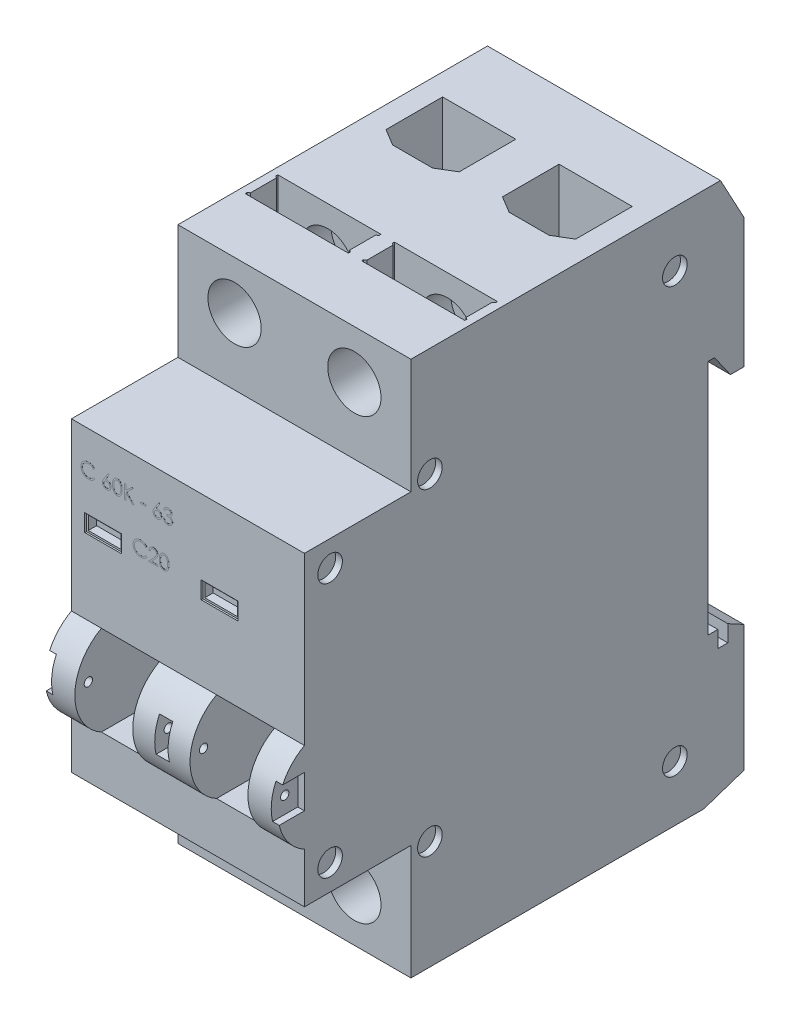
from build123d import *

# Parameters (mm, degrees)
SALIENTE_EXTRUIR1_DEPTH      = 17.5
SALIENTE_EXTRUIR1_DEPTH_BACK = 17.5
CROQUIS2_R                   = 1.85
CORTAR_EXTRUIR1_DEPTH        = 1
CORTAR_EXTRUIR2_DEPTH        = 12.5
CROQUIS4_R                   = 4
CORTAR_EXTRUIR3_DEPTH        = 18.5
CROQUIS5_W                   = 5.5
CROQUIS5_H                   = 2.6
CORTAR_EXTRUIR4_DEPTH        = 0.25
CROQUIS6_W                   = 4.940246398
CROQUIS6_H                   = 2.03169495
CROQUIS6_W_2                 = 4.94
CORTAR_EXTRUIR5_DEPTH        = 1.25
CORTAR_EXTRUIR6_DEPTH        = 10.25
CORTAR_EXTRUIR6_DEPTH_BACK   = 13.25
CROQUIS7_W                   = 8.7
CROQUIS7_H                   = 13.5
CROQUIS8_W                   = 8
CROQUIS8_H                   = 2
CORTAR_EXTRUIR7_DEPTH        = 5
CORTAR_EXTRUIR8_DEPTH        = 3
REDONDEO1_R                  = 0.25
REDONDEO2_R                  = 1
CORTAR_EXTRUIR9_DEPTH        = 3
CORTAR_EXTRUIR9_DEPTH_BACK   = 3
CROQUIS11_W                  = 2
CROQUIS11_H                  = 5
CROQUIS11_W_2                = 1
CROQUIS12_R                  = 0.625
CORTAR_EXTRUIR10_DEPTH       = 35
SALIENTE_EXTRUIR2_DEPTH      = 0.01
SALIENTE_EXTRUIR2_2_DEPTH    = 0.01
SALIENTE_EXTRUIR2_3_DEPTH    = 0.01
SALIENTE_EXTRUIR2_4_DEPTH    = 0.01
CROQUIS13_W                  = 0.814102564
CROQUIS13_H                  = 0.217094017
SALIENTE_EXTRUIR2_5_DEPTH    = 0.01
SALIENTE_EXTRUIR2_6_DEPTH    = 0.01
SALIENTE_EXTRUIR2_7_DEPTH    = 0.01
SALIENTE_EXTRUIR2_8_DEPTH    = 0.01
SALIENTE_EXTRUIR2_9_DEPTH    = 0.01
SALIENTE_EXTRUIR2_10_DEPTH   = 0.01


with BuildPart() as part:
    # Croquis1 → Saliente-Extruir1 (new, two sides: drawn at the far end of the back side and taken through both)
    with BuildSketch(Plane(origin=(0, 0, 0), x_dir=(0, 0, -1), z_dir=(1, 0, 0)).offset(-SALIENTE_EXTRUIR1_DEPTH_BACK)):
        with BuildLine():
            Line((-33, 23), (-17, 23))
            Line((-17, 23), (-17, 40.25))
            Line((-17, 40.25), (29.5, 40.25))
            Line((29.5, 40.25), (33, 33.75))
            Line((33, 33.75), (33, 14.25))
            Line((33, 14.25), (31, 14.25))
            Line((31, 14.25), (28.6, 17.65))
            Line((28.6, 17.65), (27.6, 17.65))
            Line((27.6, 17.65), (27.6, -17.95))
            Line((27.6, -17.95), (29.1, -17.95))
            Line((29.1, -17.95), (29.1, -20.45))
            Line((29.1, -20.45), (30.6, -20.45))
            Line((30.6, -20.45), (30.6, -17.95))
            Line((30.6, -17.95), (33, -19.25))
            Line((33, -19.25), (33, -38.25))
            Line((33, -38.25), (27, -40.25))
            Line((27, -40.25), (-17, -40.25))
            Line((-17, -40.25), (-17, -23))
            Line((-17, -23), (-33, -23))
            Line((-33, -23), (-33, -15.5))
            ThreePointArc((-33, -15.5), (-36.988145156, -8.75), (-33, -2))
            Line((-33, -2), (-33, 23))
        make_face()
    extrude(amount=SALIENTE_EXTRUIR1_DEPTH + SALIENTE_EXTRUIR1_DEPTH_BACK)

    # Croquis2 → Cortar-Extruir1 (cut)
    with BuildSketch(Plane(origin=(17.5, 0, 0), x_dir=(0, 0, -1), z_dir=(1, 0, 0))):
        with Locations((-14.15, 23.9)):
            Circle(CROQUIS2_R)
        with Locations((22.65, 31.9)):
            Circle(CROQUIS2_R)
        with Locations((-29.15, 19.15)):
            Circle(CROQUIS2_R)
        with Locations((22.65, -31.9)):
            Circle(CROQUIS2_R)
        with Locations((-14.15, -23.9)):
            Circle(CROQUIS2_R)
        with Locations((-29.15, -19.15)):
            Circle(CROQUIS2_R)
    cortar_extruir1 = extrude(amount=-CORTAR_EXTRUIR1_DEPTH, mode=Mode.SUBTRACT)

    # Simetría1: Cortar-Extruir1 across plane
    add(cortar_extruir1.mirror(Plane(origin=(0, 0, 0), x_dir=(0, 0, 1), z_dir=(1, 0, 0))), mode=Mode.SUBTRACT)

    # Croquis3 → Cortar-Extruir2 (cut)
    with BuildSketch(Plane(origin=(0, 40.25, 0), x_dir=(1, 0, 0), z_dir=(0, 1, 0))):
        Polygon((1, -3), (16.5, -3), (16.5, -3.3), (16.2, -3.5), (16.2, -7.4), (16.5, -7.6), (16.5, -7.9), (1, -7.9), (1, -7.6), (1.3, -7.4), (1.3, -3.5), (1, -3.3), align=None)
        Polygon((3.25, 19.5), (14.25, 19.5), (14.25, 11), (11.75, 9.5), (5.75, 9.5), (3.25, 11), align=None)
        Polygon((-3.25, 19.5), (-3.25, 11), (-5.75, 9.5), (-11.75, 9.5), (-14.25, 11), (-14.25, 19.5), align=None)
        Polygon((-1, -3), (-1, -3.3), (-1.3, -3.5), (-1.3, -7.4), (-1, -7.6), (-1, -7.9), (-16.5, -7.9), (-16.5, -7.6), (-16.2, -7.4), (-16.2, -3.5), (-16.5, -3.3), (-16.5, -3), align=None)
    cortar_extruir2 = extrude(amount=-CORTAR_EXTRUIR2_DEPTH, mode=Mode.SUBTRACT)

    # Simetría2: Cortar-Extruir2 across plane
    add(cortar_extruir2.mirror(Plane.ZX), mode=Mode.SUBTRACT)

    # Croquis4 → Cortar-Extruir3 (cut)
    with BuildSketch(Plane.XY.offset(17)):
        with Locations((9, 33)):
            Circle(CROQUIS4_R)
        with Locations((-9, 33)):
            Circle(CROQUIS4_R)
    cortar_extruir3 = extrude(amount=-CORTAR_EXTRUIR3_DEPTH, mode=Mode.SUBTRACT)

    # Simetría3: Cortar-Extruir3 across plane
    add(cortar_extruir3.mirror(Plane.ZX), mode=Mode.SUBTRACT)

    # Croquis5 → Cortar-Extruir4 (cut)
    with BuildSketch(Plane.XY.offset(33)):
        with Locations((-12.75, 10.5)):
            Rectangle(CROQUIS5_W, CROQUIS5_H)
        with Locations((4.75, 10.5)):
            Rectangle(CROQUIS5_W, CROQUIS5_H)
    extrude(amount=-CORTAR_EXTRUIR4_DEPTH, mode=Mode.SUBTRACT)

    # Croquis6 → Cortar-Extruir5 (cut)
    with BuildSketch(Plane.XY.offset(32.75)):
        with Locations((-12.75, 10.5)):
            Rectangle(CROQUIS6_W, CROQUIS6_H)
        with Locations((4.75, 10.5)):
            Rectangle(CROQUIS6_W_2, CROQUIS6_H)
    extrude(amount=-CORTAR_EXTRUIR5_DEPTH, mode=Mode.SUBTRACT)

    # Croquis7 → Cortar-Extruir6 (cut, two sides: drawn at the far end of the back side and taken through both)
    with BuildSketch(Plane.XY.offset(33).offset(-CORTAR_EXTRUIR6_DEPTH_BACK)):
        with Locations((8.65, -8.75)):
            Rectangle(CROQUIS7_W, CROQUIS7_H)
        with Locations((-8.65, -8.75)):
            Rectangle(CROQUIS7_W, CROQUIS7_H)
    extrude(amount=CORTAR_EXTRUIR6_DEPTH + CORTAR_EXTRUIR6_DEPTH_BACK, mode=Mode.SUBTRACT)

    # Croquis8 → Cortar-Extruir7 (cut)
    with BuildSketch(Plane.XZ.offset(40.25)):
        with Locations((8.75, -24)):
            Rectangle(CROQUIS8_W, CROQUIS8_H)
        with Locations((-8.75, -24)):
            Rectangle(CROQUIS8_W, CROQUIS8_H)
    extrude(amount=-CORTAR_EXTRUIR7_DEPTH, mode=Mode.SUBTRACT)

    # Croquis10 → Cortar-Extruir8 (cut)
    with BuildSketch(Plane(origin=(0, 0, -33), x_dir=(-1, 0, 0), z_dir=(0, 0, -1))):
        Polygon((13.5, -32.25), (13.5, -19.25), (13.441464629, -19.25), (13.441464629, -22.108941141), (11.2, -22.75), (11.2, -26.25), (10.2, -26.25), (10.2, -38.25), (10.3, -38.25), (10.3, -32.25), align=None)
        Polygon((4.058535371, -22.108941141), (4.058535371, -19.25), (4, -19.25), (4, -32.25), (7.2, -32.25), (7.2, -38.25), (7.3, -38.25), (7.3, -26.25), (6.3, -26.25), (6.3, -22.75), align=None)
        Polygon((-4, -32.25), (-4, -19.25), (-4.058535371, -19.25), (-4.058535371, -22.108941141), (-6.3, -22.75), (-6.3, -26.25), (-7.3, -26.25), (-7.3, -38.25), (-7.2, -38.25), (-7.2, -32.25), align=None)
        Polygon((-13.441464629, -22.108941141), (-13.441464629, -19.25), (-13.5, -19.25), (-13.5, -32.25), (-10.3, -32.25), (-10.3, -38.25), (-10.2, -38.25), (-10.2, -26.25), (-11.2, -26.25), (-11.2, -22.75), align=None)
    extrude(amount=-CORTAR_EXTRUIR8_DEPTH, mode=Mode.SUBTRACT)

    # Redondeo1
    redondeo1_edges = [part.edges().sort_by_distance(p)[0] for p in [
        (6.3, -26.25, -31.5),
        (11.2, -26.25, -31.5),
        (-6.3, -26.25, -31.5),
        (-11.2, -26.25, -31.5),
    ]]
    fillet(redondeo1_edges, radius=REDONDEO1_R)

    # Redondeo2
    redondeo2_edges = [part.edges().sort_by_distance(p)[0] for p in [
        (6.3, -22.75, -31.5),
        (-6.3, -22.75, -31.5),
        (11.2, -22.75, -31.5),
        (-11.2, -22.75, -31.5),
    ]]
    fillet(redondeo2_edges, radius=REDONDEO2_R)

    # Croquis11 → Cortar-Extruir9 (cut, two sides: drawn at the far end of the back side and taken through both)
    with BuildSketch(Plane.XY.offset(36).offset(-CORTAR_EXTRUIR9_DEPTH_BACK)):
        with Locations((0, -8)):
            Rectangle(CROQUIS11_W, CROQUIS11_H)
        with Locations((-17, -8)):
            Rectangle(CROQUIS11_W_2, CROQUIS11_H)
        with Locations((17, -8)):
            Rectangle(CROQUIS11_W_2, CROQUIS11_H)
    extrude(amount=CORTAR_EXTRUIR9_DEPTH + CORTAR_EXTRUIR9_DEPTH_BACK, mode=Mode.SUBTRACT)

    # Croquis12 → Cortar-Extruir10 (cut)
    with BuildSketch(Plane.ZY.offset(16.5)):
        with Locations((34.957141173, -8)):
            Circle(CROQUIS12_R)
    extrude(amount=-CORTAR_EXTRUIR10_DEPTH, mode=Mode.SUBTRACT)


with BuildPart() as body_2:
    # Croquis13 → Saliente-Extruir2 (new body)
    with BuildSketch(Plane.XY.offset(33)):
        with BuildLine():
            Line((-13.998063415, 18.218336224), (-14.164276022, 18.091132699))
            add(Edge.make_bspline(
                [(-14.164276022, 18.091132699), (-14.176132916, 18.105263547), (-14.199686848, 18.133334729), (-14.237580747, 18.172752835), (-14.277072693, 18.209682779), (-14.31814759, 18.244300487), (-14.361544772, 18.275395388), (-14.406212969, 18.304587912), (-14.452899406, 18.330754592), (-14.517458788, 18.362482207), (-14.601912487, 18.395590596), (-14.708226509, 18.423351122), (-14.81920703, 18.441022976), (-14.894921769, 18.442936951), (-14.93343334, 18.443910476)],
                knots=[0, 0, 0, 0, 0.757959112, 1.505699292, 2.245454638, 2.979532153, 3.711538275, 4.438200793, 5.171680507, 5.909471876, 7.393775596, 8.890124382, 10.418191784, 12, 12, 12, 12], degree=3))
            add(Edge.make_bspline(
                [(-14.93343334, 18.443910476), (-14.954650383, 18.443666175), (-14.996887555, 18.44317984), (-15.059570203, 18.436763846), (-15.121082381, 18.427746114), (-15.181384078, 18.414365561), (-15.240398534, 18.397448787), (-15.298511558, 18.37723437), (-15.354881778, 18.352224538), (-15.410288998, 18.324581924), (-15.463374521, 18.293359612), (-15.51360305, 18.259303442), (-15.560791392, 18.222794512), (-15.604976877, 18.183695986), (-15.646204674, 18.142183943), (-15.684176048, 18.097815984), (-15.718759605, 18.050733955), (-15.750640854, 18.001558704), (-15.779193316, 17.950433468), (-15.803099481, 17.897169021), (-15.824269246, 17.842677492), (-15.841020692, 17.786343219), (-15.854279805, 17.728562593), (-15.863428439, 17.669180546), (-15.869771467, 17.60832113), (-15.870255384, 17.567070736), (-15.870499312, 17.546277597)],
                knots=[0, 0, 0, 0, 1.054917814, 2.100044995, 3.131103042, 4.146048494, 5.169673617, 6.183595914, 7.203665975, 8.234915748, 9.262203917, 10.264457458, 11.251630812, 12.227803204, 13.197192746, 14.159520551, 15.12972552, 16.100847026, 17.073214652, 18.039054194, 19.002613845, 19.979014051, 20.95965708, 21.949030935, 22.966165397, 24, 24, 24, 24], degree=3))
            add(Edge.make_bspline(
                [(-15.870499312, 17.546277597), (-15.869736212, 17.514992466), (-15.868237966, 17.453568259), (-15.854903974, 17.363597462), (-15.834641371, 17.277406388), (-15.804272903, 17.195533816), (-15.76682662, 17.11697019), (-15.719509679, 17.043044788), (-15.664708249, 16.972640485), (-15.601647053, 16.907421179), (-15.532458773, 16.84784383), (-15.458225513, 16.795380383), (-15.379132158, 16.751647097), (-15.296052005, 16.715254977), (-15.208345736, 16.687280671), (-15.11617107, 16.667587129), (-15.019728482, 16.654740668), (-14.953827941, 16.653510771), (-14.920288976, 16.652884835)],
                knots=[0, 0, 0, 0, 1.029171465, 2.020641659, 2.987623507, 3.938342917, 4.889210282, 5.84687017, 6.821220943, 7.821438502, 8.827599549, 9.822697543, 10.807740252, 11.797342354, 12.80366471, 13.83203677, 14.896651826, 16, 16, 16, 16], degree=3))
            add(Edge.make_bspline(
                [(-14.920288976, 16.652884835), (-14.883336397, 16.653906145), (-14.810604883, 16.655916327), (-14.703944219, 16.672945968), (-14.60183878, 16.700558137), (-14.504283073, 16.739201166), (-14.41155212, 16.789435888), (-14.323500806, 16.850334128), (-14.240054809, 16.922475168), (-14.189876938, 16.977558774), (-14.164276022, 17.005662613)],
                knots=[0, 0, 0, 0, 1.028121516, 2.023589091, 2.998037872, 3.967518031, 4.937445131, 5.927275754, 6.942489185, 8, 8, 8, 8], degree=3))
            Line((-14.164276022, 17.005662613), (-13.998063415, 16.879731123))
            add(Edge.make_bspline(
                [(-13.998063415, 16.879731123), (-14.011439605, 16.862472154), (-14.038127914, 16.828036887), (-14.081343001, 16.779491615), (-14.126867843, 16.73382965), (-14.175040582, 16.691419136), (-14.225307055, 16.651411436), (-14.278569835, 16.614943185), (-14.334128726, 16.581505365), (-14.391795482, 16.55088813), (-14.451508834, 16.52372389), (-14.51319723, 16.500468516), (-14.576594769, 16.480435845), (-14.641704348, 16.463954912), (-14.70866102, 16.45109097), (-14.777223163, 16.442491453), (-14.847538755, 16.436599914), (-14.894977138, 16.436062936), (-14.91901694, 16.435790818)],
                knots=[0, 0, 0, 0, 0.986787822, 1.968848986, 2.935600012, 3.899624008, 4.868462664, 5.837806735, 6.815139263, 7.798259679, 8.787526145, 9.778297419, 10.776456485, 11.791383307, 12.812564526, 13.85620153, 14.913611965, 16, 16, 16, 16], degree=3))
            add(Edge.make_bspline(
                [(-14.91901694, 16.435790818), (-14.941782396, 16.435949261), (-14.986798266, 16.436262563), (-15.053260844, 16.441337826), (-15.117964067, 16.448262191), (-15.180723007, 16.458688365), (-15.241880145, 16.470991847), (-15.30088107, 16.487484464), (-15.358306363, 16.505959437), (-15.413925312, 16.527673405), (-15.467785226, 16.552176048), (-15.519712388, 16.579869039), (-15.569682916, 16.6105195), (-15.618188099, 16.643451816), (-15.6645114, 16.679723803), (-15.709054246, 16.71883172), (-15.752066411, 16.760643755), (-15.778677558, 16.790794071), (-15.792057138, 16.805953078)],
                knots=[0, 0, 0, 0, 1.114604814, 2.203992996, 3.262667896, 4.300477797, 5.318619304, 6.316056647, 7.298880507, 8.271930387, 9.238335007, 10.195173496, 11.151986948, 12.108099108, 13.064862484, 14.031167946, 15.010108607, 16, 16, 16, 16], degree=3))
            add(Edge.make_bspline(
                [(-15.792057138, 16.805953078), (-15.813487265, 16.83228513), (-15.856088797, 16.884631331), (-15.910593377, 16.969470949), (-15.957249279, 17.058049342), (-15.99497186, 17.15083187), (-16.024461703, 17.247610337), (-16.044891283, 17.348433529), (-16.058166777, 17.453207285), (-16.059684904, 17.524470486), (-16.060456577, 17.560693997)],
                knots=[0, 0, 0, 0, 0.994628077, 1.977248131, 2.950237994, 3.925870899, 4.908910175, 5.911660606, 6.938484602, 8, 8, 8, 8], degree=3))
            add(Edge.make_bspline(
                [(-16.060456577, 17.560693997), (-16.059516055, 17.598767057), (-16.057665637, 17.673673425), (-16.041944371, 17.783603388), (-16.016653956, 17.888923519), (-15.98073298, 17.989437212), (-15.935191173, 18.085673144), (-15.87893222, 18.176896158), (-15.812609711, 18.263689651), (-15.736743801, 18.344736668), (-15.653548317, 18.4188438), (-15.56445551, 18.484040885), (-15.469639762, 18.538298621), (-15.370145632, 18.583653443), (-15.265228101, 18.618514618), (-15.155111016, 18.642918688), (-15.040001291, 18.658108563), (-14.961465443, 18.660028808), (-14.921561011, 18.661004494)],
                knots=[0, 0, 0, 0, 1.032925535, 2.032216505, 3.007276963, 3.968222605, 4.92396291, 5.891752235, 6.871517503, 7.883894988, 8.900124299, 9.891468569, 10.874487609, 11.85992873, 12.854644235, 13.869047385, 14.917252991, 16, 16, 16, 16], degree=3))
            add(Edge.make_bspline(
                [(-14.921561011, 18.661004494), (-14.89724083, 18.660712915), (-14.849101482, 18.660135764), (-14.777889164, 18.654507764), (-14.708557852, 18.645125726), (-14.641059781, 18.632355531), (-14.57506658, 18.616506341), (-14.511082625, 18.595859589), (-14.448732467, 18.572251782), (-14.388409337, 18.545062615), (-14.330402661, 18.514542252), (-14.274730507, 18.481028994), (-14.221835092, 18.444564388), (-14.171344217, 18.405458563), (-14.124102508, 18.362884196), (-14.078768662, 18.318012317), (-14.0368822, 18.269550432), (-14.011026697, 18.235438877), (-13.998063415, 18.218336224)],
                knots=[0, 0, 0, 0, 1.096760587, 2.17092713, 3.219439832, 4.250915756, 5.268269357, 6.278326846, 7.281116186, 8.274029601, 9.260640565, 10.235837813, 11.203064059, 12.156899882, 13.114053108, 14.069676657, 15.032185724, 16, 16, 16, 16], degree=3))
        make_face()
    extrude(amount=SALIENTE_EXTRUIR2_DEPTH)


with BuildPart() as body_3:
    # Croquis13 → Saliente-Extruir2 2 (new body)
    with BuildSketch(Plane.XY.offset(33)):
        with BuildLine():
            Line((-11.962807005, 18.661004494), (-11.816098938, 18.546097309))
            Line((-11.816098938, 18.546097309), (-12.375370439, 17.690865605))
            add(Edge.make_bspline(
                [(-12.375370439, 17.690865605), (-12.338135081, 17.696800654), (-12.265503306, 17.708377638), (-12.191984881, 17.710287443), (-12.156156364, 17.711218169)],
                knots=[0, 0, 0, 0, 1.025318673, 2, 2, 2, 2], degree=3))
            add(Edge.make_bspline(
                [(-12.156156364, 17.711218169), (-12.13464239, 17.710648323), (-12.092432846, 17.70953031), (-12.030411832, 17.700694992), (-11.970802027, 17.68694287), (-11.913736414, 17.666815803), (-11.859142569, 17.641113402), (-11.806708313, 17.610307133), (-11.757418988, 17.572808564), (-11.710639945, 17.530919729), (-11.668169271, 17.484524227), (-11.630567562, 17.435295797), (-11.598982788, 17.383285741), (-11.573356654, 17.328520398), (-11.553457037, 17.271084189), (-11.538950223, 17.2110506), (-11.530374946, 17.148378234), (-11.529210482, 17.105755718), (-11.52861897, 17.084104787)],
                knots=[0, 0, 0, 0, 1.044136307, 2.048553127, 3.035567123, 4.010001674, 4.980053131, 5.96154148, 6.956538004, 7.981742224, 9.006487041, 10.005615874, 10.984750588, 11.954802044, 12.935714515, 13.930994945, 14.949008866, 16, 16, 16, 16], degree=3))
            add(Edge.make_bspline(
                [(-11.52861897, 17.084104787), (-11.52947961, 17.054483728), (-11.531173145, 16.996196494), (-11.548048298, 16.91130201), (-11.574270559, 16.830425679), (-11.611752207, 16.754858761), (-11.65830822, 16.684704826), (-11.715081812, 16.622544092), (-11.78005954, 16.567105546), (-11.853530128, 16.520746543), (-11.932598492, 16.482886602), (-12.015663747, 16.455693337), (-12.101919212, 16.438951429), (-12.160462951, 16.436852541), (-12.190077304, 16.435790818)],
                knots=[0, 0, 0, 0, 1.031375318, 2.029502543, 3.004789286, 3.987476834, 4.960371455, 5.9300674, 6.912260825, 7.929083631, 8.949397511, 9.960523116, 10.96833055, 12, 12, 12, 12], degree=3))
            add(Edge.make_bspline(
                [(-12.190077304, 16.435790818), (-12.218559594, 16.436715019), (-12.274978024, 16.438545699), (-12.357971191, 16.45485367), (-12.43771692, 16.481286061), (-12.513656498, 16.517701363), (-12.584002773, 16.563698273), (-12.646937706, 16.619071651), (-12.702147493, 16.682637852), (-12.74809405, 16.754387014), (-12.784536235, 16.831488084), (-12.811865381, 16.911883412), (-12.827828823, 16.995280067), (-12.830059522, 17.051813899), (-12.831183073, 17.080288682)],
                knots=[0, 0, 0, 0, 1.012016664, 2.004627821, 2.994792927, 3.992885782, 4.990978636, 5.973936114, 6.964471063, 7.975201453, 8.993600317, 9.990122807, 10.98767138, 12, 12, 12, 12], degree=3))
            add(Edge.make_bspline(
                [(-12.831183073, 17.080288682), (-12.83046858, 17.102087072), (-12.829009722, 17.146595221), (-12.818823481, 17.214004419), (-12.802455724, 17.282978169), (-12.784125242, 17.341491419), (-12.764757373, 17.389425768), (-12.748638932, 17.428072165), (-12.728576563, 17.467841957), (-12.70718409, 17.51009887), (-12.682535888, 17.55375387), (-12.655735472, 17.599536565), (-12.626041873, 17.646718836), (-12.60522587, 17.678737468), (-12.594584515, 17.695105722)],
                knots=[0, 0, 0, 0, 1.173818275, 2.396712641, 3.66331629, 4.989737886, 5.693666774, 6.447286557, 7.243889047, 8.091586357, 8.998013824, 9.943181721, 10.948533338, 12, 12, 12, 12], degree=3))
            Line((-12.594584515, 17.695105722), (-11.962807005, 18.661004494))
        make_face()
        with BuildLine():
            add(Edge.make_bspline(
                [(-12.196013468, 17.494124152), (-12.212137263, 17.493647376), (-12.243772014, 17.492711948), (-12.290126385, 17.487428912), (-12.333878708, 17.477418168), (-12.375531602, 17.464471712), (-12.414640475, 17.446834354), (-12.451690151, 17.425699788), (-12.48625421, 17.400378724), (-12.518163928, 17.3717941), (-12.547080149, 17.340469067), (-12.571985784, 17.306924672), (-12.593468157, 17.271960466), (-12.610934839, 17.23528663), (-12.624535964, 17.196916577), (-12.634374387, 17.157026943), (-12.63984975, 17.115350194), (-12.640760661, 17.087088157), (-12.641225808, 17.07265647)],
                knots=[0, 0, 0, 0, 1.128956033, 2.215002439, 3.259141796, 4.2666399, 5.263148119, 6.255916712, 7.247353359, 8.256307737, 9.250603402, 10.226115518, 11.176314381, 12.118911324, 13.063945463, 14.021379252, 14.989639887, 16, 16, 16, 16], degree=3))
            add(Edge.make_bspline(
                [(-12.641225808, 17.07265647), (-12.640847008, 17.058353863), (-12.640104239, 17.03030858), (-12.633359741, 16.988979648), (-12.623057572, 16.949207537), (-12.607732666, 16.911197284), (-12.589452595, 16.874369511), (-12.565319375, 16.840058171), (-12.538578748, 16.806179367), (-12.506614702, 16.77533562), (-12.472310573, 16.746635662), (-12.435661275, 16.721549985), (-12.397464537, 16.700089299), (-12.357204677, 16.683270206), (-12.315452892, 16.669466947), (-12.271861319, 16.659753576), (-12.22639964, 16.65426202), (-12.195603992, 16.653349922), (-12.179901022, 16.652884835)],
                knots=[0, 0, 0, 0, 0.989467248, 1.94019797, 2.891935182, 3.827694429, 4.772920941, 5.730924762, 6.725747692, 7.756678648, 8.79901574, 9.819492441, 10.826891316, 11.826466727, 12.835195252, 13.867842842, 14.912794438, 16, 16, 16, 16], degree=3))
            add(Edge.make_bspline(
                [(-12.179901022, 16.652884835), (-12.164198077, 16.653349959), (-12.13340248, 16.654262128), (-12.087940435, 16.659753166), (-12.044350213, 16.669468453), (-12.002593515, 16.683264747), (-11.962351793, 16.700109549), (-11.924188461, 16.721416472), (-11.887885757, 16.746789934), (-11.853559109, 16.775286574), (-11.821728108, 16.806354918), (-11.794346134, 16.83975575), (-11.770951988, 16.87464682), (-11.75194179, 16.91105221), (-11.736785675, 16.94923052), (-11.726431264, 16.988973491), (-11.719700694, 17.030310192), (-11.718956011, 17.058354408), (-11.718576235, 17.07265647)],
                knots=[0, 0, 0, 0, 1.087397944, 2.132534446, 3.165364764, 4.174271784, 5.174024072, 6.181601208, 7.194203697, 8.236725232, 9.267838612, 10.269026844, 11.221737037, 12.171628256, 13.107553087, 14.05945871, 15.010357665, 16, 16, 16, 16], degree=3))
            add(Edge.make_bspline(
                [(-11.718576235, 17.07265647), (-11.718909032, 17.087106983), (-11.719562204, 17.115468642), (-11.726949938, 17.157008306), (-11.737196063, 17.197119229), (-11.752667621, 17.235549529), (-11.772768135, 17.27214676), (-11.797249732, 17.307098836), (-11.825577091, 17.340661859), (-11.858274498, 17.37187439), (-11.893868126, 17.400202486), (-11.931472904, 17.425794847), (-11.971322868, 17.446637626), (-12.01269902, 17.464531702), (-12.056099723, 17.477212951), (-12.101050921, 17.487460167), (-12.147978552, 17.492667783), (-12.17989111, 17.493635339), (-12.196013468, 17.494124152)],
                knots=[0, 0, 0, 0, 0.978753431, 1.920974676, 2.853199117, 3.782215702, 4.721507756, 5.67862441, 6.671401678, 7.694929396, 8.738190014, 9.75360867, 10.774035531, 11.783329636, 12.805060902, 13.835252836, 14.906360638, 16, 16, 16, 16], degree=3))
        make_face(mode=Mode.SUBTRACT)
    extrude(amount=SALIENTE_EXTRUIR2_2_DEPTH)


with BuildPart() as body_4:
    # Croquis13 → Saliente-Extruir2 3 (new body)
    with BuildSketch(Plane.XY.offset(33)):
        with BuildLine():
            add(Edge.make_bspline(
                [(-11.311524953, 17.547549632), (-11.31132658, 17.581475195), (-11.310941238, 17.647376091), (-11.306654431, 17.743402993), (-11.299533153, 17.833488501), (-11.289773884, 17.917636927), (-11.277897582, 17.995869994), (-11.262043455, 18.067978633), (-11.244013807, 18.134296586), (-11.223117804, 18.19504011), (-11.199539475, 18.251027578), (-11.17387685, 18.303294247), (-11.145111475, 18.351761035), (-11.114887342, 18.397201508), (-11.081980994, 18.438871838), (-11.047328868, 18.477360496), (-11.009578495, 18.51177795), (-10.970013152, 18.543132618), (-10.928274624, 18.570618727), (-10.88555263, 18.594829003), (-10.841553114, 18.61551178), (-10.796155946, 18.631774091), (-10.749769161, 18.645206365), (-10.702230602, 18.654392062), (-10.653461777, 18.660171716), (-10.620543719, 18.660724267), (-10.603849339, 18.661004494)],
                knots=[0, 0, 0, 0, 1.646270934, 3.197905019, 4.663502075, 6.030701355, 7.308322542, 8.50163776, 9.611534131, 10.641858119, 11.616356847, 12.558055219, 13.465016945, 14.349605745, 15.204443733, 16.039544428, 16.859896111, 17.680448484, 18.487036065, 19.28249412, 20.06191084, 20.843045899, 21.620316918, 22.403196591, 23.190181807, 24, 24, 24, 24], degree=3))
            add(Edge.make_bspline(
                [(-10.603849339, 18.661004494), (-10.587015502, 18.660709481), (-10.553538297, 18.660122795), (-10.504044355, 18.65448403), (-10.455693834, 18.645127684), (-10.408692864, 18.631870714), (-10.362655372, 18.615423805), (-10.317941449, 18.594809215), (-10.274273357, 18.570812947), (-10.23234504, 18.542616603), (-10.191696202, 18.511179702), (-10.153325291, 18.475642279), (-10.117228815, 18.436363163), (-10.082953749, 18.393762607), (-10.051472507, 18.347023532), (-10.021492384, 18.296958856), (-9.994657867, 18.242693047), (-9.968813563, 18.185131526), (-9.946505719, 18.122681599), (-9.926387561, 18.055695292), (-9.910132185, 17.983381379), (-9.896592006, 17.906119268), (-9.886102474, 17.823625219), (-9.878462733, 17.736076066), (-9.874427105, 17.643414211), (-9.8736671, 17.580060655), (-9.87327709, 17.547549632)],
                knots=[0, 0, 0, 0, 0.810914788, 1.612654377, 2.396697861, 3.181598691, 3.963628158, 4.749916497, 5.551656086, 6.361998678, 7.18212741, 8.025565596, 8.878627764, 9.750805457, 10.657531673, 11.591944965, 12.560506719, 13.57287815, 14.630710178, 15.753379473, 16.941251878, 18.199788006, 19.531962791, 20.947069417, 22.433333509, 24, 24, 24, 24], degree=3))
            add(Edge.make_bspline(
                [(-9.87327709, 17.547549632), (-9.873671144, 17.515180412), (-9.874438941, 17.452110306), (-9.878417492, 17.359865383), (-9.886254378, 17.272780852), (-9.896057562, 17.190647858), (-9.909635049, 17.11380825), (-9.926329602, 17.041996131), (-9.944865749, 16.974901383), (-9.967746792, 16.913073664), (-9.992790412, 16.855650479), (-10.020038078, 16.802027965), (-10.04922983, 16.75173216), (-10.0810335, 16.705165646), (-10.114932468, 16.661998554), (-10.151652274, 16.622992849), (-10.190157818, 16.58720868), (-10.230926279, 16.555366982), (-10.273508503, 16.527496647), (-10.317026612, 16.502572081), (-10.362252753, 16.482474213), (-10.408162015, 16.465217307), (-10.455411074, 16.452033224), (-10.503941035, 16.442917131), (-10.553505044, 16.43652368), (-10.5870098, 16.436035951), (-10.603849339, 16.435790818)],
                knots=[0, 0, 0, 0, 1.561518951, 3.042555995, 4.452378317, 5.7783523, 7.031515105, 8.214008947, 9.334062868, 10.386615937, 11.391082383, 12.354592575, 13.286541444, 14.194233754, 15.072674879, 15.931287219, 16.775624067, 17.606195743, 18.42308326, 19.229000347, 20.022332153, 20.807536673, 21.593273796, 22.3848459, 23.188221202, 24, 24, 24, 24], degree=3))
            add(Edge.make_bspline(
                [(-10.603849339, 16.435790818), (-10.620543255, 16.436072852), (-10.6534604, 16.436628968), (-10.702235915, 16.442382511), (-10.749578155, 16.451632648), (-10.795720734, 16.464584595), (-10.840900389, 16.480438329), (-10.884501476, 16.501093176), (-10.92700879, 16.524880922), (-10.968308921, 16.551971487), (-11.0076258, 16.583008885), (-11.04518067, 16.617337765), (-11.080030087, 16.65581478), (-11.112465945, 16.697832381), (-11.143293131, 16.743004009), (-11.171650038, 16.791946406), (-11.197879078, 16.844465508), (-11.221853951, 16.900900626), (-11.243110524, 16.962075273), (-11.261886995, 17.0286893), (-11.276712224, 17.101330661), (-11.289401916, 17.179415925), (-11.299637138, 17.263280636), (-11.306624754, 17.352970321), (-11.310943549, 17.44842909), (-11.311327615, 17.513906525), (-11.311524953, 17.547549632)],
                knots=[0, 0, 0, 0, 0.810891512, 1.598919785, 2.382837074, 3.152667961, 3.926044502, 4.706494248, 5.493654104, 6.291793342, 7.103789334, 7.925228297, 8.761435821, 9.622817696, 10.50288917, 11.416980706, 12.369136599, 13.353924996, 14.394355917, 15.514179734, 16.714354668, 17.994756427, 19.357759367, 20.818452758, 22.365282078, 24, 24, 24, 24], degree=3))
        make_face()
        with BuildLine():
            add(Edge.make_bspline(
                [(-11.121567688, 17.548397656), (-11.121495451, 17.520125824), (-11.121355253, 17.465255749), (-11.117692694, 17.385521967), (-11.112703268, 17.311154197), (-11.106267817, 17.242058011), (-11.096710796, 17.178467289), (-11.086002405, 17.119944671), (-11.072970941, 17.066799866), (-11.057552526, 17.01866819), (-11.039990786, 16.974732801), (-11.020816287, 16.933850161), (-11.00021766, 16.895537323), (-10.97716465, 16.860138427), (-10.952057921, 16.827538032), (-10.925464569, 16.797159129), (-10.896392101, 16.770067621), (-10.856173171, 16.737575666), (-10.803077208, 16.703999809), (-10.736178171, 16.674761936), (-10.667435822, 16.656387783), (-10.620777685, 16.654051131), (-10.597489163, 16.652884835)],
                knots=[0, 0, 0, 0, 1.459021318, 2.831673884, 4.118529203, 5.306027144, 6.411944654, 7.436330062, 8.375795394, 9.233974572, 10.042671642, 10.816086306, 11.563610507, 12.285937304, 12.993564865, 13.685989202, 14.367179055, 15.041617293, 16.353048772, 17.594441528, 18.799311195, 20, 20, 20, 20], degree=3))
            add(Edge.make_bspline(
                [(-10.597489163, 16.652884835), (-10.574049999, 16.653851112), (-10.527220066, 16.655781671), (-10.458801056, 16.674407574), (-10.392379893, 16.702510582), (-10.340326862, 16.73574074), (-10.300725515, 16.76738692), (-10.272351906, 16.794368159), (-10.24630962, 16.824579565), (-10.221609889, 16.857175806), (-10.198956067, 16.892779641), (-10.178355979, 16.931219866), (-10.159557955, 16.972603226), (-10.148848198, 17.001492544), (-10.143372576, 17.016262907)],
                knots=[0, 0, 0, 0, 1.353760809, 2.704726607, 4.075137775, 5.516104923, 6.260822281, 7.007110065, 7.778089737, 8.566572457, 9.372053459, 10.217411131, 11.088608312, 12, 12, 12, 12], degree=3))
            add(Edge.make_bspline(
                [(-10.143372576, 17.016262907), (-10.136991269, 17.035149464), (-10.124034479, 17.073497273), (-10.107335929, 17.132983863), (-10.09418514, 17.195396963), (-10.082353962, 17.260363581), (-10.074278543, 17.328362829), (-10.067778675, 17.399184309), (-10.063950116, 17.472881418), (-10.063475529, 17.522952675), (-10.063234355, 17.548397656)],
                knots=[0, 0, 0, 0, 0.884706709, 1.796334032, 2.740027952, 3.714592787, 4.726048262, 5.777819803, 6.87074269, 8, 8, 8, 8], degree=3))
            add(Edge.make_bspline(
                [(-10.063234355, 17.548397656), (-10.063567088, 17.573838521), (-10.064217986, 17.623606292), (-10.066705969, 17.696491097), (-10.073130702, 17.765716838), (-10.08026636, 17.831581743), (-10.090787537, 17.893721212), (-10.102131544, 17.952655444), (-10.117372277, 18.007654321), (-10.133652331, 18.059578925), (-10.152285285, 18.107839321), (-10.172796229, 18.152660515), (-10.194701769, 18.194258896), (-10.218494457, 18.232520333), (-10.243891846, 18.267616204), (-10.271564269, 18.29884284), (-10.300414056, 18.327168054), (-10.340822545, 18.359500179), (-10.393723663, 18.392466775), (-10.459549364, 18.422805116), (-10.528051134, 18.440227274), (-10.574359842, 18.442683627), (-10.597489163, 18.443910476)],
                knots=[0, 0, 0, 0, 1.31362396, 2.569729283, 3.763502607, 4.902122613, 5.988968491, 7.01645872, 7.998833611, 8.933434873, 9.825090667, 10.667526885, 11.477055099, 12.250526234, 12.991942729, 13.710640831, 14.402115721, 15.076753259, 16.378508321, 17.609869233, 18.806226677, 20, 20, 20, 20], degree=3))
            add(Edge.make_bspline(
                [(-10.597489163, 18.443910476), (-10.620899854, 18.442681935), (-10.667763886, 18.440222614), (-10.736977649, 18.422870027), (-10.803322661, 18.39262409), (-10.856083889, 18.359390989), (-10.89652056, 18.327738772), (-10.924994379, 18.300290774), (-10.951692302, 18.27026661), (-10.976286578, 18.237366405), (-10.999321526, 18.202008778), (-11.020476709, 18.163915572), (-11.03953719, 18.122893747), (-11.057126409, 18.078978094), (-11.072591857, 18.03085057), (-11.085348683, 17.977771226), (-11.09713371, 17.919434749), (-11.105476563, 17.855499618), (-11.112893215, 17.786386125), (-11.117659554, 17.711832699), (-11.121367505, 17.631965193), (-11.121499624, 17.576811416), (-11.121567688, 17.548397656)],
                knots=[0, 0, 0, 0, 1.207732386, 2.417664972, 3.655092373, 4.956220595, 5.625982001, 6.301752483, 6.994047911, 7.697131622, 8.419323945, 9.170223765, 9.943494443, 10.752040957, 11.610060368, 12.549350801, 13.567764191, 14.679664412, 15.874934091, 17.154273443, 18.533957287, 20, 20, 20, 20], degree=3))
        make_face(mode=Mode.SUBTRACT)
    extrude(amount=SALIENTE_EXTRUIR2_3_DEPTH)


with BuildPart() as body_5:
    # Croquis13 → Saliente-Extruir2 4 (new body)
    with BuildSketch(Plane.XY.offset(33)):
        Polygon((-9.49336256, 18.606730989), (-9.303405295, 18.606730989), (-9.303405295, 17.800684648), (-8.421036839, 18.606730989), (-8.150093329, 18.606730989), (-9.190194157, 17.656944664), (-8.068683073, 16.490064323), (-8.322242101, 16.490064323), (-9.303405295, 17.511508633), (-9.303405295, 16.490064323), (-9.49336256, 16.490064323), align=None)
    extrude(amount=SALIENTE_EXTRUIR2_4_DEPTH)


with BuildPart() as body_6:
    # Croquis13 → Saliente-Extruir2 5 (new body)
    with BuildSketch(Plane.XY.offset(33)):
        with Locations((-6.725413842, 17.304166886)):
            Rectangle(CROQUIS13_W, CROQUIS13_H)
    extrude(amount=SALIENTE_EXTRUIR2_5_DEPTH)


with BuildPart() as body_7:
    # Croquis13 → Saliente-Extruir2 6 (new body)
    with BuildSketch(Plane.XY.offset(33)):
        with BuildLine():
            Line((-4.364516406, 18.661004494), (-4.21780834, 18.546097309))
            Line((-4.21780834, 18.546097309), (-4.777079841, 17.690865605))
            add(Edge.make_bspline(
                [(-4.777079841, 17.690865605), (-4.739844483, 17.696800654), (-4.667212707, 17.708377638), (-4.593694283, 17.710287443), (-4.557865765, 17.711218169)],
                knots=[0, 0, 0, 0, 1.025318673, 2, 2, 2, 2], degree=3))
            add(Edge.make_bspline(
                [(-4.557865765, 17.711218169), (-4.536351792, 17.710648323), (-4.494142248, 17.70953031), (-4.432121233, 17.700694992), (-4.372511429, 17.68694287), (-4.315445816, 17.666815803), (-4.26085197, 17.641113402), (-4.208417714, 17.610307133), (-4.15912839, 17.572808564), (-4.112349347, 17.530919729), (-4.069878673, 17.484524227), (-4.032276963, 17.435295797), (-4.000692189, 17.383285741), (-3.975066056, 17.328520398), (-3.955166439, 17.271084189), (-3.940659625, 17.2110506), (-3.932084347, 17.148378234), (-3.930919884, 17.105755718), (-3.930328372, 17.084104787)],
                knots=[0, 0, 0, 0, 1.044136307, 2.048553127, 3.035567123, 4.010001674, 4.980053131, 5.96154148, 6.956538004, 7.981742224, 9.006487041, 10.005615874, 10.984750588, 11.954802044, 12.935714515, 13.930994945, 14.949008866, 16, 16, 16, 16], degree=3))
            add(Edge.make_bspline(
                [(-3.930328372, 17.084104787), (-3.931189012, 17.054483728), (-3.932882547, 16.996196494), (-3.9497577, 16.91130201), (-3.975979961, 16.830425679), (-4.013461609, 16.754858761), (-4.060017622, 16.684704826), (-4.116791213, 16.622544092), (-4.181768942, 16.567105546), (-4.25523953, 16.520746543), (-4.334307894, 16.482886602), (-4.417373149, 16.455693337), (-4.503628614, 16.438951429), (-4.562172353, 16.436852541), (-4.591786705, 16.435790818)],
                knots=[0, 0, 0, 0, 1.031375318, 2.029502543, 3.004789286, 3.987476834, 4.960371455, 5.9300674, 6.912260825, 7.929083631, 8.949397511, 9.960523116, 10.96833055, 12, 12, 12, 12], degree=3))
            add(Edge.make_bspline(
                [(-4.591786705, 16.435790818), (-4.620268996, 16.436715019), (-4.676687426, 16.438545699), (-4.759680592, 16.45485367), (-4.839426322, 16.481286061), (-4.9153659, 16.517701363), (-4.985712175, 16.563698273), (-5.048647108, 16.619071651), (-5.103856895, 16.682637852), (-5.149803452, 16.754387014), (-5.186245637, 16.831488084), (-5.213574782, 16.911883412), (-5.229538225, 16.995280067), (-5.231768923, 17.051813899), (-5.232892475, 17.080288682)],
                knots=[0, 0, 0, 0, 1.012016664, 2.004627821, 2.994792927, 3.992885782, 4.990978636, 5.973936114, 6.964471063, 7.975201453, 8.993600317, 9.990122807, 10.98767138, 12, 12, 12, 12], degree=3))
            add(Edge.make_bspline(
                [(-5.232892475, 17.080288682), (-5.232177982, 17.102087072), (-5.230719124, 17.146595221), (-5.220532883, 17.214004419), (-5.204165126, 17.282978169), (-5.185834644, 17.341491419), (-5.166466775, 17.389425768), (-5.150348334, 17.428072165), (-5.130285965, 17.467841957), (-5.108893492, 17.51009887), (-5.08424529, 17.55375387), (-5.057444873, 17.599536565), (-5.027751275, 17.646718836), (-5.006935272, 17.678737468), (-4.996293917, 17.695105722)],
                knots=[0, 0, 0, 0, 1.173818275, 2.396712641, 3.66331629, 4.989737886, 5.693666774, 6.447286557, 7.243889047, 8.091586357, 8.998013824, 9.943181721, 10.948533338, 12, 12, 12, 12], degree=3))
            Line((-4.996293917, 17.695105722), (-4.364516406, 18.661004494))
        make_face()
        with BuildLine():
            add(Edge.make_bspline(
                [(-4.59772287, 17.494124152), (-4.613846664, 17.493647376), (-4.645481416, 17.492711948), (-4.691835786, 17.487428912), (-4.73558811, 17.477418168), (-4.777241004, 17.464471712), (-4.816349876, 17.446834354), (-4.853399552, 17.425699788), (-4.887963612, 17.400378724), (-4.91987333, 17.3717941), (-4.94878955, 17.340469067), (-4.973695186, 17.306924672), (-4.995177558, 17.271960466), (-5.012644241, 17.23528663), (-5.026245366, 17.196916577), (-5.036083789, 17.157026943), (-5.041559151, 17.115350194), (-5.042470063, 17.087088157), (-5.04293521, 17.07265647)],
                knots=[0, 0, 0, 0, 1.128956033, 2.215002439, 3.259141796, 4.2666399, 5.263148119, 6.255916712, 7.247353359, 8.256307737, 9.250603402, 10.226115518, 11.176314381, 12.118911324, 13.063945463, 14.021379252, 14.989639887, 16, 16, 16, 16], degree=3))
            add(Edge.make_bspline(
                [(-5.04293521, 17.07265647), (-5.04255641, 17.058353863), (-5.041813641, 17.03030858), (-5.035069142, 16.988979648), (-5.024766974, 16.949207537), (-5.009442067, 16.911197284), (-4.991161997, 16.874369511), (-4.967028777, 16.840058171), (-4.94028815, 16.806179367), (-4.908324104, 16.77533562), (-4.874019975, 16.746635662), (-4.837370676, 16.721549985), (-4.799173939, 16.700089299), (-4.758914079, 16.683270206), (-4.717162294, 16.669466947), (-4.673570721, 16.659753576), (-4.628109042, 16.65426202), (-4.597313393, 16.653349922), (-4.581610423, 16.652884835)],
                knots=[0, 0, 0, 0, 0.989467248, 1.94019797, 2.891935182, 3.827694429, 4.772920941, 5.730924762, 6.725747692, 7.756678648, 8.79901574, 9.819492441, 10.826891316, 11.826466727, 12.835195252, 13.867842842, 14.912794438, 16, 16, 16, 16], degree=3))
            add(Edge.make_bspline(
                [(-4.581610423, 16.652884835), (-4.565907479, 16.653349959), (-4.535111881, 16.654262128), (-4.489649836, 16.659753166), (-4.446059615, 16.669468453), (-4.404302917, 16.683264747), (-4.364061194, 16.700109549), (-4.325897863, 16.721416472), (-4.289595159, 16.746789934), (-4.25526851, 16.775286574), (-4.223437509, 16.806354918), (-4.196055536, 16.83975575), (-4.17266139, 16.87464682), (-4.153651191, 16.91105221), (-4.138495077, 16.94923052), (-4.128140666, 16.988973491), (-4.121410096, 17.030310192), (-4.120665413, 17.058354408), (-4.120285637, 17.07265647)],
                knots=[0, 0, 0, 0, 1.087397944, 2.132534446, 3.165364764, 4.174271784, 5.174024072, 6.181601208, 7.194203697, 8.236725232, 9.267838612, 10.269026844, 11.221737037, 12.171628256, 13.107553087, 14.05945871, 15.010357665, 16, 16, 16, 16], degree=3))
            add(Edge.make_bspline(
                [(-4.120285637, 17.07265647), (-4.120618434, 17.087106983), (-4.121271605, 17.115468642), (-4.12865934, 17.157008306), (-4.138905464, 17.197119229), (-4.154377023, 17.235549529), (-4.174477537, 17.27214676), (-4.198959134, 17.307098836), (-4.227286493, 17.340661859), (-4.2599839, 17.37187439), (-4.295577528, 17.400202486), (-4.333182305, 17.425794847), (-4.37303227, 17.446637626), (-4.414408422, 17.464531702), (-4.457809125, 17.477212951), (-4.502760322, 17.487460167), (-4.549687954, 17.492667783), (-4.581600512, 17.493635339), (-4.59772287, 17.494124152)],
                knots=[0, 0, 0, 0, 0.978753431, 1.920974676, 2.853199117, 3.782215702, 4.721507756, 5.67862441, 6.671401678, 7.694929396, 8.738190014, 9.75360867, 10.774035531, 11.783329636, 12.805060902, 13.835252836, 14.906360638, 16, 16, 16, 16], degree=3))
        make_face(mode=Mode.SUBTRACT)
    extrude(amount=SALIENTE_EXTRUIR2_6_DEPTH)


with BuildPart() as body_8:
    # Croquis13 → Saliente-Extruir2 7 (new body)
    with BuildSketch(Plane.XY.offset(33)):
        with BuildLine():
            Line((-3.441866834, 18.118269451), (-3.631824099, 18.118269451))
            add(Edge.make_bspline(
                [(-3.631824099, 18.118269451), (-3.626677846, 18.139576715), (-3.616617345, 18.181230673), (-3.595633574, 18.240743636), (-3.572774024, 18.297061194), (-3.545324423, 18.34912882), (-3.515383415, 18.397992918), (-3.481079673, 18.442545198), (-3.443995841, 18.483918753), (-3.402977896, 18.520635807), (-3.359961991, 18.553884243), (-3.314342006, 18.582232492), (-3.26703578, 18.606619003), (-3.217715552, 18.626709334), (-3.166234487, 18.641843817), (-3.113058, 18.652824362), (-3.05804674, 18.659955178), (-3.02070415, 18.660651116), (-3.001742635, 18.661004494)],
                knots=[0, 0, 0, 0, 1.162005537, 2.271625781, 3.343758855, 4.383309926, 5.390229558, 6.379919256, 7.361854164, 8.333198761, 9.295911338, 10.242430842, 11.177959212, 12.116337295, 13.062827104, 14.020064771, 14.994644689, 16, 16, 16, 16], degree=3))
            add(Edge.make_bspline(
                [(-3.001742635, 18.661004494), (-2.974115453, 18.660170388), (-2.919463718, 18.65852037), (-2.839173684, 18.643453068), (-2.761747941, 18.61961025), (-2.688033968, 18.586666615), (-2.619563773, 18.546034287), (-2.558642365, 18.497674661), (-2.506095503, 18.442520798), (-2.462011761, 18.38160158), (-2.427494976, 18.316495629), (-2.40204274, 18.249487915), (-2.386547724, 18.180737389), (-2.384539577, 18.134317511), (-2.3835335, 18.111061251)],
                knots=[0, 0, 0, 0, 1.083050992, 2.142477498, 3.193116406, 4.255571735, 5.30263384, 6.308962982, 7.297363603, 8.282367274, 9.249857812, 10.179914175, 11.08814088, 12, 12, 12, 12], degree=3))
            add(Edge.make_bspline(
                [(-2.3835335, 18.111061251), (-2.384237196, 18.088680951), (-2.385614219, 18.044886178), (-2.397306507, 17.980949844), (-2.4169832, 17.9206904), (-2.444239675, 17.863854173), (-2.479522422, 17.810801532), (-2.522262577, 17.761413112), (-2.572761806, 17.71546986), (-2.611030497, 17.68915094), (-2.630732352, 17.675601182)],
                knots=[0, 0, 0, 0, 1.024540389, 2.004866551, 2.965041327, 3.920577974, 4.882998113, 5.874504559, 6.905732034, 8, 8, 8, 8], degree=3))
            add(Edge.make_bspline(
                [(-2.630732352, 17.675601182), (-2.608216005, 17.664728668), (-2.56360461, 17.643187075), (-2.50279548, 17.600940974), (-2.447594098, 17.552163088), (-2.416809468, 17.514097769), (-2.401341994, 17.494972175)],
                knots=[0, 0, 0, 0, 1.015518401, 2.012035669, 3.001164323, 4, 4, 4, 4], degree=3))
            add(Edge.make_bspline(
                [(-2.401341994, 17.494972175), (-2.391156992, 17.481027725), (-2.370953773, 17.453367176), (-2.346016094, 17.408895147), (-2.323392486, 17.363930199), (-2.305763544, 17.317267129), (-2.292111729, 17.269446783), (-2.282353272, 17.220387048), (-2.276291053, 17.170047863), (-2.275422886, 17.13599222), (-2.274986492, 17.118873751)],
                knots=[0, 0, 0, 0, 1.025084078, 2.033381695, 3.024893161, 4.013698104, 4.991890475, 5.976764909, 6.982997093, 8, 8, 8, 8], degree=3))
            add(Edge.make_bspline(
                [(-2.274986492, 17.118873751), (-2.276071745, 17.089234539), (-2.278237145, 17.030095597), (-2.29759199, 16.942722789), (-2.327596188, 16.857314985), (-2.370205858, 16.775626868), (-2.422135257, 16.699196828), (-2.483916115, 16.630812584), (-2.554846466, 16.572030571), (-2.63395274, 16.522917719), (-2.71965786, 16.483657832), (-2.811325004, 16.456408807), (-2.90763337, 16.438661465), (-2.973677783, 16.436758358), (-3.007254788, 16.435790818)],
                knots=[0, 0, 0, 0, 0.955779014, 1.907060117, 2.875433937, 3.871313158, 4.872415639, 5.851225146, 6.836215519, 7.83643374, 8.849228613, 9.86973379, 10.916971861, 12, 12, 12, 12], degree=3))
            add(Edge.make_bspline(
                [(-3.007254788, 16.435790818), (-3.029884555, 16.436315881), (-3.074412391, 16.437349028), (-3.139873935, 16.444411801), (-3.202358963, 16.457311376), (-3.261951958, 16.474670041), (-3.318705861, 16.496678381), (-3.372447486, 16.524085403), (-3.423507469, 16.556326168), (-3.471403978, 16.593781243), (-3.516131302, 16.635679958), (-3.556500807, 16.682766121), (-3.593185539, 16.734169313), (-3.62520323, 16.79048659), (-3.654012244, 16.85099015), (-3.677707394, 16.916454718), (-3.698562952, 16.986295055), (-3.708259381, 17.034964927), (-3.713234355, 17.059936117)],
                knots=[0, 0, 0, 0, 1.048658725, 2.063410685, 3.046034179, 4.001477787, 4.936774919, 5.862367409, 6.792675028, 7.730719943, 8.675894397, 9.627829632, 10.600096036, 11.597688215, 12.626045268, 13.701542398, 14.82072376, 16, 16, 16, 16], degree=3))
            Line((-3.713234355, 17.059936117), (-3.52327709, 17.059936117))
            add(Edge.make_bspline(
                [(-3.52327709, 17.059936117), (-3.518328147, 17.043638381), (-3.508702023, 17.011937868), (-3.492316424, 16.966314445), (-3.473648469, 16.924490289), (-3.453622045, 16.886158591), (-3.432589366, 16.850941852), (-3.409055102, 16.819771293), (-3.384762333, 16.791277814), (-3.366450534, 16.775224644), (-3.357488495, 16.767368008)],
                knots=[0, 0, 0, 0, 1.198163088, 2.33053128, 3.407730985, 4.417276592, 5.372219308, 6.28897303, 7.162600585, 8, 8, 8, 8], degree=3))
            add(Edge.make_bspline(
                [(-3.357488495, 16.767368008), (-3.345637232, 16.758231064), (-3.321971288, 16.739985378), (-3.283406691, 16.71670106), (-3.242848403, 16.696525582), (-3.199417624, 16.681114014), (-3.154051548, 16.668064667), (-3.106016904, 16.659525115), (-3.055737472, 16.653666078), (-3.021406492, 16.653149048), (-3.003862694, 16.652884835)],
                knots=[0, 0, 0, 0, 0.946170439, 1.889420265, 2.845303464, 3.807233317, 4.801018734, 5.828864929, 6.890507805, 8, 8, 8, 8], degree=3))
            add(Edge.make_bspline(
                [(-3.003862694, 16.652884835), (-2.984054623, 16.653257311), (-2.945321651, 16.653985656), (-2.888803712, 16.660683822), (-2.835035875, 16.670438881), (-2.784615105, 16.685505304), (-2.736880941, 16.704120391), (-2.692502515, 16.727493474), (-2.650897251, 16.754916234), (-2.612598039, 16.786085154), (-2.578159566, 16.820206725), (-2.547837098, 16.855895582), (-2.522059327, 16.89300125), (-2.501265448, 16.931729066), (-2.48484583, 16.971918657), (-2.473667894, 17.013682806), (-2.465895787, 17.056679724), (-2.465262836, 17.085907244), (-2.464943757, 17.100641246)],
                knots=[0, 0, 0, 0, 1.217147791, 2.380027433, 3.494444702, 4.572153297, 5.609568379, 6.639424714, 7.649109417, 8.668170816, 9.669597737, 10.625200337, 11.543417969, 12.441394052, 13.322311151, 14.205496177, 15.095365482, 16, 16, 16, 16], degree=3))
            add(Edge.make_bspline(
                [(-2.464943757, 17.100641246), (-2.465869225, 17.120363341), (-2.467715556, 17.159709397), (-2.481811697, 17.21759574), (-2.504997581, 17.273368947), (-2.537456671, 17.326077448), (-2.576969231, 17.374927636), (-2.623151818, 17.418513723), (-2.676387937, 17.454478969), (-2.725385667, 17.479327823), (-2.7687865, 17.496283578), (-2.805928185, 17.507577485), (-2.847509559, 17.517140982), (-2.89302778, 17.526038403), (-2.94282582, 17.533610837), (-2.996849466, 17.53992565), (-3.055109665, 17.54497846), (-3.095441941, 17.547234884), (-3.116225808, 17.548397656)],
                knots=[0, 0, 0, 0, 1.07054697, 2.135767047, 3.216561865, 4.33974944, 5.486079747, 6.621378074, 7.775625952, 8.963672916, 9.598146892, 10.304877434, 11.070270905, 11.915000392, 12.823868403, 13.805723172, 14.86925407, 16, 16, 16, 16], degree=3))
            Line((-3.116225808, 17.548397656), (-3.116225808, 17.765491673))
            add(Edge.make_bspline(
                [(-3.116225808, 17.765491673), (-3.090038913, 17.765936054), (-3.038745217, 17.766806488), (-2.963818661, 17.77733419), (-2.892170516, 17.791897236), (-2.825388629, 17.814203995), (-2.764520121, 17.840112175), (-2.711712552, 17.870260892), (-2.667705754, 17.903773621), (-2.632713582, 17.941167628), (-2.606388763, 17.981272442), (-2.587141128, 18.023071564), (-2.575771407, 18.066931353), (-2.574253656, 18.096863843), (-2.573490765, 18.111909274)],
                knots=[0, 0, 0, 0, 1.321986639, 2.589447074, 3.816329219, 5.01088745, 6.139805852, 7.153945165, 8.075214402, 8.924034688, 9.728124013, 10.488707548, 11.240355623, 12, 12, 12, 12], degree=3))
            add(Edge.make_bspline(
                [(-2.573490765, 18.111909274), (-2.573741385, 18.122962958), (-2.574239982, 18.144953738), (-2.580527859, 18.177081756), (-2.589976684, 18.208227566), (-2.602966806, 18.238258718), (-2.620353831, 18.266966932), (-2.641161261, 18.29459696), (-2.665937207, 18.320991055), (-2.694328025, 18.345592963), (-2.724815164, 18.36903912), (-2.758228124, 18.388944034), (-2.793559448, 18.405965095), (-2.830848253, 18.420001318), (-2.87021555, 18.430560031), (-2.911476373, 18.43814123), (-2.954709401, 18.442881145), (-2.984204686, 18.443563568), (-2.999198564, 18.443910476)],
                knots=[0, 0, 0, 0, 0.884392785, 1.759457502, 2.611959086, 3.489218968, 4.37281399, 5.2945488, 6.255912374, 7.266815255, 8.301784654, 9.332968512, 10.37626691, 11.440494194, 12.520033166, 13.637162961, 14.798855837, 16, 16, 16, 16], degree=3))
            add(Edge.make_bspline(
                [(-2.999198564, 18.443910476), (-3.023299335, 18.443069034), (-3.070373746, 18.4414255), (-3.138237052, 18.427030345), (-3.201325412, 18.404062646), (-3.249548319, 18.376646963), (-3.285158257, 18.349583606), (-3.310604786, 18.325948067), (-3.335593857, 18.29968155), (-3.358481481, 18.269166247), (-3.381628124, 18.236468712), (-3.402700787, 18.199926771), (-3.423177839, 18.160493637), (-3.435516524, 18.132616754), (-3.441866834, 18.118269451)],
                knots=[0, 0, 0, 0, 1.472543308, 2.876219568, 4.221790263, 5.565193594, 6.249813518, 6.953379497, 7.687249741, 8.463570142, 9.283606569, 10.136032583, 11.040678096, 12, 12, 12, 12], degree=3))
        make_face()
    extrude(amount=SALIENTE_EXTRUIR2_7_DEPTH)


with BuildPart() as body_9:
    # Croquis13 → Saliente-Extruir2 8 (new body)
    with BuildSketch(Plane.XY.offset(33)):
        with BuildLine():
            Line((-6.159208571, 11.995542145), (-6.325421178, 11.868338619))
            add(Edge.make_bspline(
                [(-6.325421178, 11.868338619), (-6.337278072, 11.882469468), (-6.360832005, 11.91054065), (-6.398725903, 11.949958756), (-6.438217849, 11.986888699), (-6.479292746, 12.021506408), (-6.522689928, 12.052601309), (-6.567358125, 12.081793833), (-6.614044562, 12.107960513), (-6.678603945, 12.139688128), (-6.763057643, 12.172796517), (-6.869371665, 12.200557043), (-6.980352186, 12.218228896), (-7.056066925, 12.220142872), (-7.094578496, 12.221116397)],
                knots=[0, 0, 0, 0, 0.757959112, 1.505699292, 2.245454638, 2.979532153, 3.711538275, 4.438200793, 5.171680507, 5.909471876, 7.393775596, 8.890124382, 10.418191784, 12, 12, 12, 12], degree=3))
            add(Edge.make_bspline(
                [(-7.094578496, 12.221116397), (-7.115795539, 12.220872096), (-7.158032711, 12.220385761), (-7.220715359, 12.213969766), (-7.282227538, 12.204952035), (-7.342529234, 12.191571482), (-7.40154369, 12.174654708), (-7.459656714, 12.154440291), (-7.516026934, 12.129430459), (-7.571434154, 12.101787844), (-7.624519677, 12.070565533), (-7.674748206, 12.036509363), (-7.721936548, 12.000000433), (-7.766122033, 11.960901907), (-7.80734983, 11.919389864), (-7.845321204, 11.875021905), (-7.879904762, 11.827939876), (-7.91178601, 11.778764625), (-7.940338473, 11.727639389), (-7.964244638, 11.674374942), (-7.985414402, 11.619883413), (-8.002165849, 11.563549139), (-8.015424961, 11.505768514), (-8.024573596, 11.446386466), (-8.030916624, 11.385527051), (-8.03140054, 11.344276657), (-8.031644469, 11.323483518)],
                knots=[0, 0, 0, 0, 1.054917814, 2.100044995, 3.131103042, 4.146048494, 5.169673617, 6.183595914, 7.203665975, 8.234915748, 9.262203917, 10.264457458, 11.251630812, 12.227803204, 13.197192746, 14.159520551, 15.12972552, 16.100847026, 17.073214652, 18.039054194, 19.002613845, 19.979014051, 20.95965708, 21.949030935, 22.966165397, 24, 24, 24, 24], degree=3))
            add(Edge.make_bspline(
                [(-8.031644469, 11.323483518), (-8.030881369, 11.292198386), (-8.029383123, 11.23077418), (-8.01604913, 11.140803382), (-7.995786527, 11.054612308), (-7.965418059, 10.972739737), (-7.927971777, 10.894176111), (-7.880654835, 10.820250709), (-7.825853406, 10.749846406), (-7.762792209, 10.684627099), (-7.69360393, 10.625049751), (-7.619370669, 10.572586304), (-7.540277314, 10.528853018), (-7.457197161, 10.492460898), (-7.369490893, 10.464486591), (-7.277316226, 10.44479305), (-7.180873639, 10.431946589), (-7.114973097, 10.430716691), (-7.081434132, 10.430090756)],
                knots=[0, 0, 0, 0, 1.029171465, 2.020641659, 2.987623507, 3.938342917, 4.889210282, 5.84687017, 6.821220943, 7.821438502, 8.827599549, 9.822697543, 10.807740252, 11.797342354, 12.80366471, 13.83203677, 14.896651826, 16, 16, 16, 16], degree=3))
            add(Edge.make_bspline(
                [(-7.081434132, 10.430090756), (-7.044481554, 10.431112066), (-6.971750039, 10.433122248), (-6.865089376, 10.450151889), (-6.762983936, 10.477764058), (-6.665428229, 10.516407087), (-6.572697276, 10.566641809), (-6.484645963, 10.627540049), (-6.401199965, 10.699681088), (-6.351022095, 10.754764695), (-6.325421178, 10.782868534)],
                knots=[0, 0, 0, 0, 1.028121516, 2.023589091, 2.998037872, 3.967518031, 4.937445131, 5.927275754, 6.942489185, 8, 8, 8, 8], degree=3))
            Line((-6.325421178, 10.782868534), (-6.159208571, 10.656937044))
            add(Edge.make_bspline(
                [(-6.159208571, 10.656937044), (-6.172584761, 10.639678075), (-6.199273071, 10.605242807), (-6.242488157, 10.556697535), (-6.288012999, 10.511035571), (-6.336185738, 10.468625057), (-6.386452212, 10.428617357), (-6.439714991, 10.392149106), (-6.495273882, 10.358711286), (-6.552940639, 10.32809405), (-6.61265399, 10.300929811), (-6.674342387, 10.277674437), (-6.737739925, 10.257641765), (-6.802849504, 10.241160832), (-6.869806176, 10.228296891), (-6.93836832, 10.219697373), (-7.008683911, 10.213805835), (-7.056122294, 10.213268857), (-7.080162097, 10.212996739)],
                knots=[0, 0, 0, 0, 0.986787822, 1.968848986, 2.935600012, 3.899624008, 4.868462664, 5.837806735, 6.815139263, 7.798259679, 8.787526145, 9.778297419, 10.776456485, 11.791383307, 12.812564526, 13.85620153, 14.913611965, 16, 16, 16, 16], degree=3))
            add(Edge.make_bspline(
                [(-7.080162097, 10.212996739), (-7.102927553, 10.213155182), (-7.147943422, 10.213468484), (-7.214406001, 10.218543747), (-7.279109223, 10.225468112), (-7.341868164, 10.235894286), (-7.403025301, 10.248197768), (-7.462026226, 10.264690385), (-7.51945152, 10.283165357), (-7.575070469, 10.304879325), (-7.628930382, 10.329381969), (-7.680857545, 10.35707496), (-7.730828073, 10.387725421), (-7.779333256, 10.420657736), (-7.825656556, 10.456929724), (-7.870199403, 10.496037641), (-7.913211567, 10.537849676), (-7.939822714, 10.567999992), (-7.953202294, 10.583158999)],
                knots=[0, 0, 0, 0, 1.114604814, 2.203992996, 3.262667896, 4.300477797, 5.318619304, 6.316056647, 7.298880507, 8.271930387, 9.238335007, 10.195173496, 11.151986948, 12.108099108, 13.064862484, 14.031167946, 15.010108607, 16, 16, 16, 16], degree=3))
            add(Edge.make_bspline(
                [(-7.953202294, 10.583158999), (-7.974632422, 10.609491051), (-8.017233953, 10.661837252), (-8.071738533, 10.746676869), (-8.118394435, 10.835255262), (-8.156117016, 10.928037791), (-8.185606859, 11.024816258), (-8.206036439, 11.12563945), (-8.219311934, 11.230413206), (-8.220830061, 11.301676407), (-8.221601734, 11.337899917)],
                knots=[0, 0, 0, 0, 0.994628077, 1.977248131, 2.950237994, 3.925870899, 4.908910175, 5.911660606, 6.938484602, 8, 8, 8, 8], degree=3))
            add(Edge.make_bspline(
                [(-8.221601734, 11.337899917), (-8.220661212, 11.375972977), (-8.218810794, 11.450879346), (-8.203089527, 11.560809308), (-8.177799112, 11.66612944), (-8.141878137, 11.766643133), (-8.096336329, 11.862879065), (-8.040077377, 11.954102079), (-7.973754867, 12.040895572), (-7.897888957, 12.121942588), (-7.814693473, 12.196049721), (-7.725600667, 12.261246806), (-7.630784918, 12.315504542), (-7.531290789, 12.360859364), (-7.426373257, 12.395720539), (-7.316256172, 12.420124609), (-7.201146448, 12.435314484), (-7.1226106, 12.437234729), (-7.082706167, 12.438210414)],
                knots=[0, 0, 0, 0, 1.032925535, 2.032216505, 3.007276963, 3.968222605, 4.92396291, 5.891752235, 6.871517503, 7.883894988, 8.900124299, 9.891468569, 10.874487609, 11.85992873, 12.854644235, 13.869047385, 14.917252991, 16, 16, 16, 16], degree=3))
            add(Edge.make_bspline(
                [(-7.082706167, 12.438210414), (-7.058385987, 12.437918835), (-7.010246638, 12.437341685), (-6.93903432, 12.431713684), (-6.869703008, 12.422331646), (-6.802204938, 12.409561452), (-6.736211737, 12.393712262), (-6.672227781, 12.37306551), (-6.609877623, 12.349457703), (-6.549554493, 12.322268536), (-6.491547817, 12.291748173), (-6.435875663, 12.258234915), (-6.382980248, 12.221770309), (-6.332489373, 12.182664484), (-6.285247665, 12.140090117), (-6.239913818, 12.095218237), (-6.198027357, 12.046756353), (-6.172171853, 12.012644798), (-6.159208571, 11.995542145)],
                knots=[0, 0, 0, 0, 1.096760587, 2.17092713, 3.219439832, 4.250915756, 5.268269357, 6.278326846, 7.281116186, 8.274029601, 9.260640565, 10.235837813, 11.203064059, 12.156899882, 13.114053108, 14.069676657, 15.032185724, 16, 16, 16, 16], degree=3))
        make_face()
    extrude(amount=SALIENTE_EXTRUIR2_8_DEPTH)


with BuildPart() as body_10:
    # Croquis13 → Saliente-Extruir2 9 (new body)
    with BuildSketch(Plane.XY.offset(33)):
        with BuildLine():
            Line((-5.643610281, 11.732654859), (-5.833567546, 11.732654859))
            add(Edge.make_bspline(
                [(-5.833567546, 11.732654859), (-5.832329505, 11.757855824), (-5.829898027, 11.80734985), (-5.818511395, 11.879512403), (-5.802218579, 11.9484884), (-5.779182319, 12.013724015), (-5.750573284, 12.075796055), (-5.716265125, 12.134457969), (-5.675628844, 12.189485974), (-5.629541914, 12.240369941), (-5.579486594, 12.287050043), (-5.525477764, 12.327360595), (-5.468723867, 12.361419377), (-5.409397087, 12.389892319), (-5.34682808, 12.411264511), (-5.281584637, 12.42712236), (-5.213380112, 12.436663293), (-5.166910194, 12.437688839), (-5.143276413, 12.438210414)],
                knots=[0, 0, 0, 0, 1.10065271, 2.161652631, 3.183658789, 4.190468796, 5.17591951, 6.163126047, 7.15150782, 8.156236427, 9.156009102, 10.134482811, 11.092018607, 12.041330605, 13.001268258, 13.972401359, 14.968799086, 16, 16, 16, 16], degree=3))
            add(Edge.make_bspline(
                [(-5.143276413, 12.438210414), (-5.120066816, 12.437667062), (-5.074460786, 12.436599394), (-5.007899473, 12.427430581), (-4.944534157, 12.413070152), (-4.884488698, 12.392922258), (-4.828242173, 12.365838342), (-4.775372046, 12.33330364), (-4.725248889, 12.295675456), (-4.680129549, 12.25137434), (-4.638698472, 12.204080517), (-4.60295568, 12.153590214), (-4.572346767, 12.101442027), (-4.546833265, 12.047238305), (-4.528051695, 11.990468683), (-4.513792493, 11.93195966), (-4.505732581, 11.871105608), (-4.504495587, 11.829917358), (-4.503866691, 11.808976974)],
                knots=[0, 0, 0, 0, 1.111607364, 2.184268762, 3.212621178, 4.221274766, 5.211760367, 6.196651075, 7.1921475, 8.207485113, 9.220403448, 10.201281604, 11.166441695, 12.114753415, 13.065576456, 14.026450734, 14.996634279, 16, 16, 16, 16], degree=3))
            add(Edge.make_bspline(
                [(-4.503866691, 11.808976974), (-4.504886709, 11.779494947), (-4.506908847, 11.72104826), (-4.524359676, 11.635048481), (-4.55132123, 11.551648755), (-4.584022539, 11.484532852), (-4.617054977, 11.430723017), (-4.646192282, 11.386021653), (-4.681058229, 11.338350439), (-4.721333807, 11.287229244), (-4.766411433, 11.232501697), (-4.816615542, 11.174145338), (-4.87232965, 11.112779963), (-4.911432455, 11.070866448), (-4.931694549, 11.049147914)],
                knots=[0, 0, 0, 0, 1.184203166, 2.347625244, 3.513805382, 4.700623107, 5.337941753, 6.051866363, 6.845199593, 7.711357327, 8.668078039, 9.695487809, 10.805859518, 12, 12, 12, 12], degree=3))
            Line((-4.931694549, 11.049147914), (-5.461285227, 10.48436426))
            Line((-5.461285227, 10.48436426), (-4.476729939, 10.48436426))
            Line((-4.476729939, 10.48436426), (-4.476729939, 10.267270243))
            Line((-4.476729939, 10.267270243), (-5.914977802, 10.267270243))
            Line((-5.914977802, 10.267270243), (-5.09409105, 11.143278523))
            add(Edge.make_bspline(
                [(-5.09409105, 11.143278523), (-5.074104947, 11.164141785), (-5.035715733, 11.204215841), (-4.981418651, 11.262722297), (-4.932651263, 11.316999401), (-4.889097887, 11.366944599), (-4.851703339, 11.413288452), (-4.818518703, 11.454530011), (-4.791929989, 11.492481512), (-4.763073535, 11.536472264), (-4.73512508, 11.59018257), (-4.71110856, 11.655819611), (-4.696464342, 11.723387997), (-4.694707608, 11.769048752), (-4.693823956, 11.792016504)],
                knots=[0, 0, 0, 0, 1.329631726, 2.553950428, 3.673215718, 4.687767853, 5.603093632, 6.413772471, 7.123043292, 7.734684054, 8.834405432, 9.900288307, 10.943827018, 12, 12, 12, 12], degree=3))
            add(Edge.make_bspline(
                [(-4.693823956, 11.792016504), (-4.694208429, 11.806459064), (-4.69496615, 11.834922576), (-4.701653425, 11.876654631), (-4.711759302, 11.916910494), (-4.726240482, 11.955813992), (-4.745355034, 11.992973982), (-4.768622269, 12.028435696), (-4.795467688, 12.062719023), (-4.82652298, 12.094864113), (-4.860638518, 12.124304651), (-4.89667885, 12.150384455), (-4.934809151, 12.172179536), (-4.974868653, 12.190046318), (-5.016745675, 12.204061906), (-5.060521212, 12.213773523), (-5.106074307, 12.219871025), (-5.137179326, 12.220696024), (-5.153028683, 12.221116397)],
                knots=[0, 0, 0, 0, 0.991446411, 1.95395049, 2.89581595, 3.838931463, 4.798493298, 5.75982156, 6.748411868, 7.785213223, 8.824556874, 9.840280684, 10.836137867, 11.835679398, 12.848801643, 13.863922112, 14.911575587, 16, 16, 16, 16], degree=3))
            add(Edge.make_bspline(
                [(-5.153028683, 12.221116397), (-5.16958152, 12.220683973), (-5.202088559, 12.219834763), (-5.249815784, 12.21389439), (-5.295345754, 12.203646191), (-5.338793, 12.189629822), (-5.380231035, 12.171814413), (-5.419458338, 12.149624644), (-5.456386847, 12.123146055), (-5.491085983, 12.093125338), (-5.523056103, 12.059701598), (-5.551145405, 12.02244224), (-5.57568907, 11.982027565), (-5.597103226, 11.938566622), (-5.614493572, 11.89166505), (-5.627782096, 11.841489343), (-5.638296999, 11.788257365), (-5.64180977, 11.751496861), (-5.643610281, 11.732654859)],
                knots=[0, 0, 0, 0, 1.031018746, 2.02475058, 2.990194455, 3.934040569, 4.864654155, 5.795059489, 6.735614925, 7.690564532, 8.649604399, 9.611025574, 10.590972636, 11.591080095, 12.624614302, 13.701020113, 14.821632451, 16, 16, 16, 16], degree=3))
        make_face()
    extrude(amount=SALIENTE_EXTRUIR2_9_DEPTH)


with BuildPart() as body_11:
    # Croquis13 → Saliente-Extruir2 10 (new body)
    with BuildSketch(Plane.XY.offset(33)):
        with BuildLine():
            add(Edge.make_bspline(
                [(-4.286772674, 11.324755553), (-4.286574301, 11.358681116), (-4.286188959, 11.424582011), (-4.281902152, 11.520608914), (-4.274780873, 11.610694422), (-4.265021605, 11.694842848), (-4.253145303, 11.773075915), (-4.237291175, 11.845184554), (-4.219261528, 11.911502506), (-4.198365525, 11.972246031), (-4.174787195, 12.028233499), (-4.149124571, 12.080500168), (-4.120359195, 12.128966956), (-4.090135062, 12.174407429), (-4.057228714, 12.216077759), (-4.022576588, 12.254566417), (-3.984826216, 12.288983871), (-3.945260873, 12.320338539), (-3.903522344, 12.347824648), (-3.860800351, 12.372034923), (-3.816800834, 12.3927177), (-3.771403667, 12.408980012), (-3.725016882, 12.422412286), (-3.677478322, 12.431597982), (-3.628709497, 12.437377637), (-3.595791439, 12.437930188), (-3.579097059, 12.438210414)],
                knots=[0, 0, 0, 0, 1.646270934, 3.197905019, 4.663502075, 6.030701355, 7.308322542, 8.50163776, 9.611534131, 10.641858119, 11.616356847, 12.558055219, 13.465016945, 14.349605745, 15.204443733, 16.039544428, 16.859896111, 17.680448484, 18.487036065, 19.28249412, 20.06191084, 20.843045899, 21.620316918, 22.403196591, 23.190181807, 24, 24, 24, 24], degree=3))
            add(Edge.make_bspline(
                [(-3.579097059, 12.438210414), (-3.562263222, 12.437915402), (-3.528786017, 12.437328716), (-3.479292076, 12.431689951), (-3.430941554, 12.422333605), (-3.383940584, 12.409076635), (-3.337903093, 12.392629725), (-3.29318917, 12.372015136), (-3.249521078, 12.348018868), (-3.207592761, 12.319822523), (-3.166943922, 12.288385623), (-3.128573011, 12.252848199), (-3.092476535, 12.213569084), (-3.05820147, 12.170968528), (-3.026720228, 12.124229453), (-2.996740104, 12.074164777), (-2.969905587, 12.019898968), (-2.944061284, 11.962337447), (-2.92175344, 11.89988752), (-2.901635282, 11.832901212), (-2.885379905, 11.760587299), (-2.871839726, 11.683325189), (-2.861350194, 11.60083114), (-2.853710453, 11.513281987), (-2.849674826, 11.420620132), (-2.848914821, 11.357266575), (-2.848524811, 11.324755553)],
                knots=[0, 0, 0, 0, 0.810914788, 1.612654377, 2.396697861, 3.181598691, 3.963628158, 4.749916497, 5.551656086, 6.361998678, 7.18212741, 8.025565596, 8.878627764, 9.750805457, 10.657531673, 11.591944965, 12.560506719, 13.57287815, 14.630710178, 15.753379473, 16.941251878, 18.199788006, 19.531962791, 20.947069417, 22.433333509, 24, 24, 24, 24], degree=3))
            add(Edge.make_bspline(
                [(-2.848524811, 11.324755553), (-2.848918864, 11.292386333), (-2.849686661, 11.229316227), (-2.853665212, 11.137071303), (-2.861502099, 11.049986772), (-2.871305282, 10.967853778), (-2.884882769, 10.891014171), (-2.901577322, 10.819202052), (-2.92011347, 10.752107304), (-2.942994512, 10.690279585), (-2.968038132, 10.6328564), (-2.995285798, 10.579233886), (-3.02447755, 10.528938081), (-3.05628122, 10.482371567), (-3.090180189, 10.439204474), (-3.126899995, 10.400198769), (-3.165405539, 10.364414601), (-3.206174, 10.332572903), (-3.248756224, 10.304702568), (-3.292274332, 10.279778002), (-3.337500474, 10.259680134), (-3.383409735, 10.242423228), (-3.430658795, 10.229239145), (-3.479188755, 10.220123052), (-3.528752764, 10.2137296), (-3.56225752, 10.213241872), (-3.579097059, 10.212996739)],
                knots=[0, 0, 0, 0, 1.561518951, 3.042555995, 4.452378317, 5.7783523, 7.031515105, 8.214008947, 9.334062868, 10.386615937, 11.391082383, 12.354592575, 13.286541444, 14.194233754, 15.072674879, 15.931287219, 16.775624067, 17.606195743, 18.42308326, 19.229000347, 20.022332153, 20.807536673, 21.593273796, 22.3848459, 23.188221202, 24, 24, 24, 24], degree=3))
            add(Edge.make_bspline(
                [(-3.579097059, 10.212996739), (-3.595790976, 10.213278773), (-3.628708121, 10.213834889), (-3.677483635, 10.219588431), (-3.724825875, 10.228838569), (-3.770968455, 10.241790515), (-3.816148109, 10.25764425), (-3.859749197, 10.278299097), (-3.90225651, 10.302086843), (-3.943556642, 10.329177407), (-3.98287352, 10.360214806), (-4.020428391, 10.394543686), (-4.055277807, 10.433020701), (-4.087713665, 10.475038302), (-4.118540852, 10.52020993), (-4.146897759, 10.569152327), (-4.173126799, 10.621671429), (-4.197101672, 10.678106547), (-4.218358244, 10.739281193), (-4.237134716, 10.80589522), (-4.251959944, 10.878536581), (-4.264649636, 10.956621846), (-4.274884858, 11.040486556), (-4.281872474, 11.130176241), (-4.286191269, 11.225635011), (-4.286575336, 11.291112446), (-4.286772674, 11.324755553)],
                knots=[0, 0, 0, 0, 0.810891512, 1.598919785, 2.382837074, 3.152667961, 3.926044502, 4.706494248, 5.493654104, 6.291793342, 7.103789334, 7.925228297, 8.761435821, 9.622817696, 10.50288917, 11.416980706, 12.369136599, 13.353924996, 14.394355917, 15.514179734, 16.714354668, 17.994756427, 19.357759367, 20.818452758, 22.365282078, 24, 24, 24, 24], degree=3))
        make_face()
        with BuildLine():
            add(Edge.make_bspline(
                [(-4.096815409, 11.325603577), (-4.096743172, 11.297331745), (-4.096602974, 11.24246167), (-4.092940414, 11.162727888), (-4.087950988, 11.088360118), (-4.081515537, 11.019263932), (-4.071958516, 10.95567321), (-4.061250125, 10.897150592), (-4.048218662, 10.844005787), (-4.032800246, 10.795874111), (-4.015238506, 10.751938722), (-3.996064008, 10.711056082), (-3.97546538, 10.672743244), (-3.95241237, 10.637344348), (-3.927305641, 10.604743953), (-3.90071229, 10.57436505), (-3.871639822, 10.547273542), (-3.831420892, 10.514781587), (-3.778324929, 10.48120573), (-3.711425892, 10.451967856), (-3.642683543, 10.433593704), (-3.596025406, 10.431257052), (-3.572736883, 10.430090756)],
                knots=[0, 0, 0, 0, 1.459021318, 2.831673884, 4.118529203, 5.306027144, 6.411944654, 7.436330062, 8.375795394, 9.233974572, 10.042671642, 10.816086306, 11.563610507, 12.285937304, 12.993564865, 13.685989202, 14.367179055, 15.041617293, 16.353048772, 17.594441528, 18.799311195, 20, 20, 20, 20], degree=3))
            add(Edge.make_bspline(
                [(-3.572736883, 10.430090756), (-3.54929772, 10.431057033), (-3.502467786, 10.432987592), (-3.434048777, 10.451613495), (-3.367627613, 10.479716502), (-3.315574583, 10.51294666), (-3.275973235, 10.544592841), (-3.247599627, 10.57157408), (-3.22155734, 10.601785486), (-3.196857609, 10.634381727), (-3.174203788, 10.669985562), (-3.153603699, 10.708425786), (-3.134805675, 10.749809146), (-3.124095919, 10.778698465), (-3.118620297, 10.793468828)],
                knots=[0, 0, 0, 0, 1.353760809, 2.704726607, 4.075137775, 5.516104923, 6.260822281, 7.007110065, 7.778089737, 8.566572457, 9.372053459, 10.217411131, 11.088608312, 12, 12, 12, 12], degree=3))
            add(Edge.make_bspline(
                [(-3.118620297, 10.793468828), (-3.112238989, 10.812355384), (-3.099282199, 10.850703194), (-3.08258365, 10.910189784), (-3.069432861, 10.972602884), (-3.057601683, 11.037569502), (-3.049526263, 11.10556875), (-3.043026395, 11.17639023), (-3.039197837, 11.250087339), (-3.038723249, 11.300158596), (-3.038482075, 11.325603577)],
                knots=[0, 0, 0, 0, 0.884706709, 1.796334032, 2.740027952, 3.714592787, 4.726048262, 5.777819803, 6.87074269, 8, 8, 8, 8], degree=3))
            add(Edge.make_bspline(
                [(-3.038482075, 11.325603577), (-3.038814809, 11.351044442), (-3.039465707, 11.400812213), (-3.04195369, 11.473697018), (-3.048378423, 11.542922759), (-3.055514081, 11.608787664), (-3.066035257, 11.670927132), (-3.077379264, 11.729861365), (-3.092619997, 11.784860241), (-3.108900052, 11.836784846), (-3.127533005, 11.885045241), (-3.148043949, 11.929866436), (-3.169949489, 11.971464817), (-3.193742177, 12.009726253), (-3.219139567, 12.044822125), (-3.246811989, 12.07604876), (-3.275661777, 12.104373974), (-3.316070265, 12.136706099), (-3.368971383, 12.169672696), (-3.434797084, 12.200011037), (-3.503298855, 12.217433195), (-3.549607563, 12.219889548), (-3.572736883, 12.221116397)],
                knots=[0, 0, 0, 0, 1.31362396, 2.569729283, 3.763502607, 4.902122613, 5.988968491, 7.01645872, 7.998833611, 8.933434873, 9.825090667, 10.667526885, 11.477055099, 12.250526234, 12.991942729, 13.710640831, 14.402115721, 15.076753259, 16.378508321, 17.609869233, 18.806226677, 20, 20, 20, 20], degree=3))
            add(Edge.make_bspline(
                [(-3.572736883, 12.221116397), (-3.596147575, 12.219887856), (-3.643011606, 12.217428534), (-3.712225369, 12.200075948), (-3.778570382, 12.169830011), (-3.831331609, 12.13659691), (-3.87176828, 12.104944693), (-3.9002421, 12.077496694), (-3.926940023, 12.047472531), (-3.951534299, 12.014572325), (-3.974569246, 11.979214699), (-3.99572443, 11.941121493), (-4.01478491, 11.900099668), (-4.03237413, 11.856184014), (-4.047839578, 11.808056491), (-4.060596403, 11.754977147), (-4.07238143, 11.69664067), (-4.080724283, 11.632705539), (-4.088140936, 11.563592046), (-4.092907275, 11.48903862), (-4.096615226, 11.409171114), (-4.096747345, 11.354017337), (-4.096815409, 11.325603577)],
                knots=[0, 0, 0, 0, 1.207732386, 2.417664972, 3.655092373, 4.956220595, 5.625982001, 6.301752483, 6.994047911, 7.697131622, 8.419323945, 9.170223765, 9.943494443, 10.752040957, 11.610060368, 12.549350801, 13.567764191, 14.679664412, 15.874934091, 17.154273443, 18.533957287, 20, 20, 20, 20], degree=3))
        make_face(mode=Mode.SUBTRACT)
    extrude(amount=SALIENTE_EXTRUIR2_10_DEPTH)


solid = Compound([part.part, body_2.part, body_3.part, body_4.part, body_5.part, body_6.part, body_7.part, body_8.part, body_9.part, body_10.part, body_11.part])
